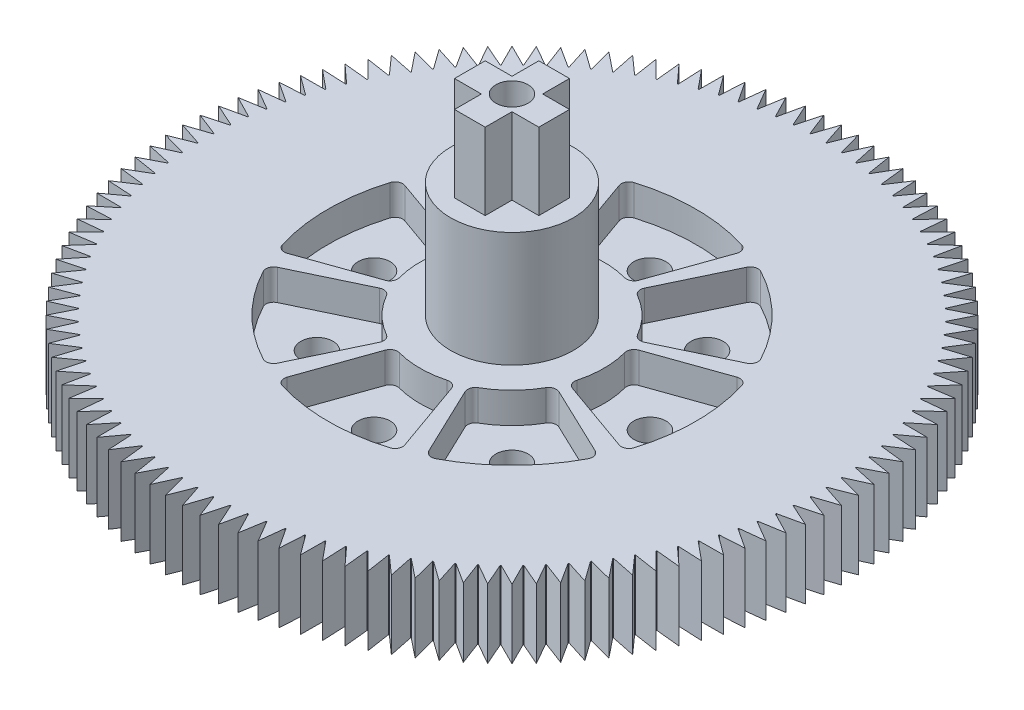
from build123d import *

# Parameters (mm, degrees)
SKETCH_1_R               = 25
SKETCH_1_R_2             = 2.1
EXTRUDE_1_DEPTH          = 5
SKETCH_2_R               = 25
SKETCH_2_R_2             = 24
SKETCH_2_R_3             = 12
EXTRUDE_2_DEPTH          = 4
FILLET_1_R               = 1
SKETCH_3_R               = 8
EXTRUDE_3_DEPTH          = 15
EXTRUDE_4_DEPTH          = 10
EXTRUDE_5_DEPTH          = 4
EXTRUDE_5_DEPTH_BACK     = 5
SKETCH_5_R               = 40
SKETCH_5_R_2             = 25
EXTRUDE_6_DEPTH          = 4
EXTRUDE_6_DEPTH_BACK     = 5
EXTRUDE_7_DEPTH          = 4
EXTRUDE_7_DEPTH_BACK     = 5
EXTRUDE_8_DEPTH          = 4
EXTRUDE_8_DEPTH_BACK     = 5
CUT_EXTRUDE_1_DEPTH      = 70.670653793
CUT_EXTRUDE_1_DEPTH_BACK = 70.670653793
SKETCH_6_R               = 2.1


with BuildPart() as part:
    # Эскиз1 → Бобышка-Вытянуть1 (new body)
    with BuildSketch(Plane(origin=(0, 0, 0), x_dir=(1, 0, 0), z_dir=(0, 1, 0))):
        with Locations(Location((0, 0, 0), (0, 0, 270))):
            Circle(SKETCH_1_R)
        with Locations(Location((-18, 0, 0), (0, 0, 270))):
            Circle(SKETCH_1_R_2, mode=Mode.SUBTRACT)
        with Locations(Location((-12.727922061, 12.727922061, 0), (0, 0, 270))):
            Circle(SKETCH_1_R_2, mode=Mode.SUBTRACT)
        with Locations(Location((0, 18, 0), (0, 0, 270))):
            Circle(SKETCH_1_R_2, mode=Mode.SUBTRACT)
        with Locations(Location((12.727922061, 12.727922061, 0), (0, 0, 270))):
            Circle(SKETCH_1_R_2, mode=Mode.SUBTRACT)
        with Locations(Location((18, 0, 0), (0, 0, 270))):
            Circle(SKETCH_1_R_2, mode=Mode.SUBTRACT)
        with Locations(Location((12.727922061, -12.727922061, 0), (0, 0, 270))):
            Circle(SKETCH_1_R_2, mode=Mode.SUBTRACT)
        with Locations(Location((0, -18, 0), (0, 0, 270))):
            Circle(SKETCH_1_R_2, mode=Mode.SUBTRACT)
        with Locations(Location((-12.727922061, -12.727922061, 0), (0, 0, 270))):
            Circle(SKETCH_1_R_2, mode=Mode.SUBTRACT)
    extrude(amount=EXTRUDE_1_DEPTH)

    # Эскиз2 → Бобышка-Вытянуть2 (add)
    # profile 1 of 10: a face of its own
    with BuildSketch(Plane(origin=(0, 5, 0), x_dir=(1, 0, 0), z_dir=(0, 1, 0))):
        with Locations(Location((0, 0, 0), (0, 0, 270))):
            Circle(SKETCH_2_R)
        Circle(SKETCH_2_R_2, mode=Mode.SUBTRACT)
    # profile 2 of 10: a face of its own
    with BuildSketch(Plane(origin=(0, 5, 0), x_dir=(1, 0, 0), z_dir=(0, 1, 0))):
        Circle(SKETCH_2_R_3)
    # profile 3 of 10: a face of its own
    with BuildSketch(Plane(origin=(0, 5, 0), x_dir=(1, 0, 0), z_dir=(0, 1, 0))):
        with BuildLine():
            Line((-10.332266323, 21.662046824), (-5.166133162, 10.831023412))
            ThreePointArc((-5.166133162, 10.831023412), (-4.592201188, 11.08655439), (-4.005682311, 11.311697893))
            Line((-4.005682311, 11.311697893), (-8.011364622, 22.623395786))
            ThreePointArc((-8.011364622, 22.623395786), (-9.184402377, 22.17310878), (-10.332266323, 21.662046824))
        make_face()
    # profile 4 of 10: a face of its own
    with BuildSketch(Plane(origin=(0, 5, 0), x_dir=(1, 0, 0), z_dir=(0, 1, 0))):
        with BuildLine():
            Line((8.011364622, 22.623395786), (4.005682311, 11.311697893))
            ThreePointArc((4.005682311, 11.311697893), (4.592201188, 11.08655439), (5.166133162, 10.831023412))
            Line((5.166133162, 10.831023412), (10.332266323, 21.662046824))
            ThreePointArc((10.332266323, 21.662046824), (9.184402377, 22.17310878), (8.011364622, 22.623395786))
        make_face()
    # profile 5 of 10: a face of its own
    with BuildSketch(Plane(origin=(0, 5, 0), x_dir=(1, 0, 0), z_dir=(0, 1, 0))):
        with BuildLine():
            ThreePointArc((10.831023412, 5.166133162), (11.08655439, 4.592201188), (11.311697893, 4.005682311))
            Line((11.311697893, 4.005682311), (22.623395786, 8.011364622))
            ThreePointArc((22.623395786, 8.011364622), (22.17310878, 9.184402377), (21.662046824, 10.332266323))
            Line((21.662046824, 10.332266323), (10.831023412, 5.166133162))
        make_face()
    # profile 6 of 10: a face of its own
    with BuildSketch(Plane(origin=(0, 5, 0), x_dir=(1, 0, 0), z_dir=(0, 1, 0))):
        with BuildLine():
            ThreePointArc((11.311697893, -4.005682311), (11.08655439, -4.592201188), (10.831023412, -5.166133162))
            Line((10.831023412, -5.166133162), (21.662046824, -10.332266323))
            ThreePointArc((21.662046824, -10.332266323), (22.17310878, -9.184402377), (22.623395786, -8.011364622))
            Line((22.623395786, -8.011364622), (11.311697893, -4.005682311))
        make_face()
    # profile 7 of 10: a face of its own
    with BuildSketch(Plane(origin=(0, 5, 0), x_dir=(1, 0, 0), z_dir=(0, 1, 0))):
        with BuildLine():
            ThreePointArc((5.166133162, -10.831023412), (4.592201188, -11.08655439), (4.005682311, -11.311697893))
            Line((4.005682311, -11.311697893), (8.011364622, -22.623395786))
            ThreePointArc((8.011364622, -22.623395786), (9.184402377, -22.17310878), (10.332266323, -21.662046824))
            Line((10.332266323, -21.662046824), (5.166133162, -10.831023412))
        make_face()
    # profile 8 of 10: a face of its own
    with BuildSketch(Plane(origin=(0, 5, 0), x_dir=(1, 0, 0), z_dir=(0, 1, 0))):
        with BuildLine():
            ThreePointArc((-4.005682311, -11.311697893), (-4.592201188, -11.08655439), (-5.166133162, -10.831023412))
            Line((-5.166133162, -10.831023412), (-10.332266323, -21.662046824))
            ThreePointArc((-10.332266323, -21.662046824), (-9.184402377, -22.17310878), (-8.011364622, -22.623395786))
            Line((-8.011364622, -22.623395786), (-4.005682311, -11.311697893))
        make_face()
    # profile 9 of 10: a face of its own
    with BuildSketch(Plane(origin=(0, 5, 0), x_dir=(1, 0, 0), z_dir=(0, 1, 0))):
        with BuildLine():
            Line((-21.662046824, -10.332266323), (-10.831023412, -5.166133162))
            ThreePointArc((-10.831023412, -5.166133162), (-11.08655439, -4.592201188), (-11.311697893, -4.005682311))
            Line((-11.311697893, -4.005682311), (-22.623395786, -8.011364622))
            ThreePointArc((-22.623395786, -8.011364622), (-22.17310878, -9.184402377), (-21.662046824, -10.332266323))
        make_face()
    # profile 10 of 10: a face of its own
    with BuildSketch(Plane(origin=(0, 5, 0), x_dir=(1, 0, 0), z_dir=(0, 1, 0))):
        with BuildLine():
            Line((-22.623395786, 8.011364622), (-11.311697893, 4.005682311))
            ThreePointArc((-11.311697893, 4.005682311), (-11.08655439, 4.592201188), (-10.831023412, 5.166133162))
            Line((-10.831023412, 5.166133162), (-21.662046824, 10.332266323))
            ThreePointArc((-21.662046824, 10.332266323), (-22.17310878, 9.184402377), (-22.623395786, 8.011364622))
        make_face()
    extrude(amount=EXTRUDE_2_DEPTH)

    # Скругление1
    fillet_1_edges = [part.edges().sort_by_distance(p)[0] for p in [
        (5.166133162, 7, 10.831023412),
        (10.831023412, 7, 5.166133162),
        (21.662046824, 7, 10.332266323),
        (22.623395786, 7, 8.011364622),
        (11.311697893, 7, 4.005682311),
        (11.311697893, 7, -4.005682311),
        (21.662046824, 7, -10.332266323),
        (10.831023412, 7, -5.166133162),
        (5.166133162, 7, -10.831023412),
        (8.011364622, 7, -22.623395786),
        (4.005682311, 7, -11.311697893),
        (-4.005682311, 7, -11.311697893),
        (-10.332266323, 7, -21.662046824),
        (-5.166133162, 7, -10.831023412),
        (-10.831023412, 7, -5.166133162),
        (-22.623395786, 7, -8.011364622),
        (-11.311697893, 7, -4.005682311),
        (-11.311697893, 7, 4.005682311),
        (-21.662046824, 7, 10.332266323),
        (-10.831023412, 7, 5.166133162),
        (-5.166133162, 7, 10.831023412),
        (-8.011364622, 7, 22.623395786),
        (-4.005682311, 7, 11.311697893),
        (4.005682311, 7, 11.311697893),
        (10.332266323, 7, 21.662046824),
        (22.623395786, 7, -8.011364622),
        (10.332266323, 7, -21.662046824),
        (-8.011364622, 7, -22.623395786),
        (-21.662046824, 7, -10.332266323),
        (-22.623395786, 7, 8.011364622),
        (-10.332266323, 7, 21.662046824),
        (8.011364622, 7, 22.623395786),
    ]]
    fillet(fillet_1_edges, radius=FILLET_1_R)

    # Эскиз3 → Бобышка-Вытянуть3 (add)
    with BuildSketch(Plane(origin=(0, 9, 0), x_dir=(1, 0, 0), z_dir=(0, 1, 0))):
        with Locations(Location((0, 0, 0), (0, 0, 270))):
            Circle(SKETCH_3_R)
    extrude(amount=EXTRUDE_3_DEPTH)

    # Эскиз4 → Бобышка-Вытянуть4 (add)
    with BuildSketch(Plane(origin=(0, 24, 0), x_dir=(1, 0, 0), z_dir=(0, 1, 0))):
        Polygon((-2, -5.5), (-2, -2), (-5.5, -2), (-5.5, 2), (-2, 2), (-2, 5.5), (2, 5.5), (2, 2), (5.5, 2), (5.5, -2), (2, -2), (2, -5.5), align=None)
    extrude(amount=EXTRUDE_4_DEPTH)

    # Эскиз5 → Бобышка-Вытянуть5 (add, two sides: drawn at the far end of the back side and taken through both)
    with BuildSketch(Plane(origin=(0, 5, 0), x_dir=(1, 0, 0), z_dir=(0, 1, 0)).offset(-EXTRUDE_5_DEPTH_BACK)):
        with Locations(Location((0, 0, 0), (0, 0, 270))):
            Circle(SKETCH_5_R)
        Circle(SKETCH_5_R_2, mode=Mode.SUBTRACT)
    extrude(amount=EXTRUDE_5_DEPTH + EXTRUDE_5_DEPTH_BACK)

    # Эскиз5<4> → Бобышка-Вытянуть6 (add, two sides: drawn at the far end of the back side and taken through both)
    with BuildSketch(Plane(origin=(0, 5, 0), x_dir=(1, 0, 0), z_dir=(0, 1, 0)).offset(-EXTRUDE_6_DEPTH_BACK)):
        with BuildLine():
            Line((0, 43), (-0.999921872, 39.9875))
            ThreePointArc((-0.999921872, 39.9875), (-3.0395e-05, 40), (0.999861101, 39.98750152))
            Line((0.999861101, 39.98750152), (0, 43))
        make_face()
        with BuildLine():
            ThreePointArc((-7.243034345, 39.338765276), (-6.257408622, 39.507528869), (-5.267872256, 39.651601757))
            Line((-5.267872256, 39.651601757), (-6.726681997, 42.470598646))
            Line((-6.726681997, 42.470598646), (-7.243034345, 39.338765276))
        make_face()
        with BuildLine():
            Line((6.726681997, 42.470598646), (5.267811996, 39.651609763))
            ThreePointArc((5.267811996, 39.651609763), (6.257348581, 39.507538379), (7.242974561, 39.338776284))
            Line((7.242974561, 39.338776284), (6.726681997, 42.470598646))
        make_face()
        with BuildLine():
            ThreePointArc((-11.315376926, 38.366160155), (-10.352791163, 38.637025185), (-9.383735299, 38.883743542))
            Line((-9.383735299, 38.883743542), (-11.129218939, 41.53481053))
            Line((-11.129218939, 41.53481053), (-11.315376926, 38.366160155))
        make_face()
        with BuildLine():
            Line((11.129218939, 41.53481053), (9.383676206, 38.883757803))
            ThreePointArc((9.383676206, 38.883757803), (10.352732445, 38.637040918), (11.31531862, 38.366177351))
            Line((11.31531862, 38.366177351), (11.129218939, 41.53481053))
        make_face()
        with BuildLine():
            ThreePointArc((-17.177855599, 36.123694122), (-16.26949349, 36.541805943), (-15.350963566, 36.937080524))
            Line((-15.350963566, 36.937080524), (-17.489675652, 39.282454679))
            Line((-17.489675652, 39.282454679), (-17.177855599, 36.123694122))
        make_face()
        with BuildLine():
            Line((17.489675652, 39.282454679), (15.350907431, 36.937103853))
            ThreePointArc((15.350907431, 36.937103853), (16.269437956, 36.541830668), (17.177800701, 36.123720228))
            Line((17.177800701, 36.123720228), (17.489675652, 39.282454679))
        make_face()
        with BuildLine():
            ThreePointArc((-22.617358457, 32.991742852), (-21.785586892, 33.546806164), (-20.940200162, 34.080903996))
            Line((-20.940200162, 34.080903996), (-23.419478506, 36.062834422))
            Line((-23.419478506, 36.062834422), (-22.617358457, 32.991742852))
        make_face()
        with BuildLine():
            Line((23.419478506, 36.062834422), (20.940148368, 34.080935819))
            ThreePointArc((20.940148368, 34.080935819), (21.785535909, 33.546839272), (22.617308318, 32.991777225))
            Line((22.617308318, 32.991777225), (23.419478506, 36.062834422))
        make_face()
        with BuildLine():
            ThreePointArc((-25.942034382, 30.44685291), (-25.172839263, 31.08581933), (-24.387912076, 31.705358294))
            Line((-24.387912076, 31.705358294), (-27.060776815, 33.417276343))
            Line((-27.060776815, 33.417276343), (-25.942034382, 30.44685291))
        make_face()
        with BuildLine():
            Line((27.060776815, 33.417276343), (24.387863893, 31.705395357))
            ThreePointArc((24.387863893, 31.705395357), (25.172792021, 31.085857586), (25.94198811, 30.446892335))
            Line((25.94198811, 30.446892335), (27.060776815, 33.417276343))
        make_face()
        with BuildLine():
            ThreePointArc((-30.385582037, 26.013773357), (-29.725813357, 26.765201667), (-29.047467173, 27.499902742))
            Line((-29.047467173, 27.499902742), (-31.955227496, 28.772616073))
            Line((-31.955227496, 28.772616073), (-30.385582037, 26.013773357))
        make_face()
        with BuildLine():
            Line((31.955227496, 28.772616073), (29.04742538, 27.499946887))
            ThreePointArc((29.04742538, 27.499946887), (29.725772681, 26.765246842), (30.385542503, 26.013819535))
            Line((30.385542503, 26.013819535), (31.955227496, 28.772616073))
        make_face()
        with BuildLine():
            ThreePointArc((-34.080935819, 20.940148368), (-33.546839272, 21.785535909), (-32.991777225, 22.617308318))
            Line((-32.991777225, 22.617308318), (-36.062834422, 23.419478506))
            Line((-36.062834422, 23.419478506), (-34.080935819, 20.940148368))
        make_face()
        with BuildLine():
            Line((36.062834422, 23.419478506), (32.991742852, 22.617358457))
            ThreePointArc((32.991742852, 22.617358457), (33.546806164, 21.785586892), (34.080903996, 20.940200162))
            Line((34.080903996, 20.940200162), (36.062834422, 23.419478506))
        make_face()
        with BuildLine():
            ThreePointArc((-36.083078416, 17.263008197), (-35.640274766, 18.159592908), (-35.175197299, 19.044828563))
            Line((-35.175197299, 19.044828563), (-38.31328054, 19.521591489))
            Line((-38.31328054, 19.521591489), (-36.083078416, 17.263008197))
        make_face()
        with BuildLine():
            Line((38.31328054, 19.521591489), (35.175168356, 19.04488202))
            ThreePointArc((35.175168356, 19.04488202), (35.640247169, 18.159647071), (36.083052181, 17.263063034))
            Line((36.083052181, 17.263063034), (38.31328054, 19.521591489))
        make_face()
        with BuildLine():
            ThreePointArc((-38.339365297, 11.40583485), (-38.042270044, 12.360650868), (-37.721399818, 13.307741948))
            Line((-37.721399818, 13.307741948), (-40.895430201, 13.287730758))
            Line((-40.895430201, 13.287730758), (-38.339365297, 11.40583485))
        make_face()
        with BuildLine():
            Line((40.895430201, 13.287730758), (37.721379594, 13.307799275))
            ThreePointArc((37.721379594, 13.307799275), (38.042251259, 12.360708682), (38.339347963, 11.405893116))
            Line((38.339347963, 11.405893116), (40.895430201, 13.287730758))
        make_face()
        with BuildLine():
            ThreePointArc((-39.651609763, 5.267811996), (-39.507538379, 6.257348581), (-39.338776284, 7.242974561))
            Line((-39.338776284, 7.242974561), (-42.470598646, 6.726681997))
            Line((-42.470598646, 6.726681997), (-39.651609763, 5.267811996))
        make_face()
        with BuildLine():
            Line((42.470598646, 6.726681997), (39.338765276, 7.243034345))
            ThreePointArc((39.338765276, 7.243034345), (39.507528869, 6.257408622), (39.651601757, 5.267872256))
            Line((39.651601757, 5.267872256), (42.470598646, 6.726681997))
        make_face()
        with BuildLine():
            ThreePointArc((-39.985030388, 1.094232536), (-39.945182981, 2.093407897), (-39.880371352, 3.091274956))
            Line((-39.880371352, 3.091274956), (-42.941069994, 2.250446118))
            Line((-42.941069994, 2.250446118), (-39.985030388, 1.094232536))
        make_face()
        with BuildLine():
            Line((42.941069994, 2.250446118), (39.880366654, 3.091335564))
            ThreePointArc((39.880366654, 3.091335564), (39.945179799, 2.093468603), (39.985028725, 1.094293303))
            Line((39.985028725, 1.094293303), (42.941069994, 2.250446118))
        make_face()
        with BuildLine():
            ThreePointArc((-39.663923994, -5.17427612), (-39.780872638, -4.181168759), (-39.872959747, -3.185448326))
            Line((-39.872959747, -3.185448326), (-42.764441501, -4.494723921))
            Line((-42.764441501, -4.494723921), (-39.663923994, -5.17427612))
        make_face()
        with BuildLine():
            Line((42.764441501, -4.494723921), (39.872964588, -3.18538773))
            ThreePointArc((39.872964588, -3.18538773), (39.780878992, -4.181108302), (39.663931858, -5.174215841))
            Line((39.663931858, -5.174215841), (42.764441501, -4.494723921))
        make_face()
        with BuildLine():
            ThreePointArc((-38.366160155, -11.315376926), (-38.637025185, -10.352791163), (-38.883743542, -9.383735299))
            Line((-38.883743542, -9.383735299), (-41.53481053, -11.129218939))
            Line((-41.53481053, -11.129218939), (-38.366160155, -11.315376926))
        make_face()
        with BuildLine():
            Line((41.53481053, -11.129218939), (38.883757803, -9.383676206))
            ThreePointArc((38.883757803, -9.383676206), (38.637040918, -10.352732445), (38.366177351, -11.31531862))
            Line((38.366177351, -11.31531862), (41.53481053, -11.129218939))
        make_face()
        with BuildLine():
            ThreePointArc((-36.973207354, -15.26374587), (-37.343206167, -14.334746358), (-37.689866896, -13.396788173))
            Line((-37.689866896, -13.396788173), (-40.143958339, -15.40982183))
            Line((-40.143958339, -15.40982183), (-36.973207354, -15.26374587))
        make_face()
        with BuildLine():
            Line((40.143958339, -15.40982183), (37.689887256, -13.396730895))
            ThreePointArc((37.689887256, -13.396730895), (37.343227952, -14.334689606), (36.97323055, -15.263689681))
            Line((36.97323055, -15.263689681), (40.143958339, -15.40982183))
        make_face()
        with BuildLine():
            ThreePointArc((-34.130229898, -20.859707743), (-34.641000954, -20.000026323), (-35.130122701, -19.127845646))
            Line((-35.130122701, -19.127845646), (-37.239092363, -21.5))
            Line((-37.239092363, -21.5), (-34.130229898, -20.859707743))
        make_face()
        with BuildLine():
            Line((37.239092363, -21.5), (35.13015177, -19.127792257))
            ThreePointArc((35.13015177, -19.127792257), (34.641031349, -19.999973677), (34.130261599, -20.859655874))
            Line((34.130261599, -20.859655874), (37.239092363, -21.5))
        make_face()
        with BuildLine():
            ThreePointArc((-30.44685291, -25.942034382), (-31.08581933, -25.172839263), (-31.705358294, -24.387912076))
            Line((-31.705358294, -24.387912076), (-33.417276343, -27.060776815))
            Line((-33.417276343, -27.060776815), (-30.44685291, -25.942034382))
        make_face()
        with BuildLine():
            Line((33.417276343, -27.060776815), (31.705395357, -24.387863893))
            ThreePointArc((31.705395357, -24.387863893), (31.085857586, -25.172792021), (30.446892335, -25.94198811))
            Line((30.446892335, -25.94198811), (33.417276343, -27.060776815))
        make_face()
        with BuildLine():
            ThreePointArc((-27.568380876, -28.982483949), (-28.284249755, -28.28429274), (-28.982442052, -27.568424922))
            Line((-28.982442052, -27.568424922), (-30.405591591, -30.405591591))
            Line((-30.405591591, -30.405591591), (-27.568380876, -28.982483949))
        make_face()
        with BuildLine():
            Line((30.405591591, -30.405591591), (28.982483949, -27.568380876))
            ThreePointArc((28.982483949, -27.568380876), (28.28429274, -28.284249755), (27.568424922, -28.982442052))
            Line((27.568424922, -28.982442052), (30.405591591, -30.405591591))
        make_face()
        with BuildLine():
            ThreePointArc((-22.695108989, -32.938306392), (-23.511385502, -32.360697641), (-24.312968292, -31.762864682))
            Line((-24.312968292, -31.762864682), (-25.274765849, -34.787730758))
            Line((-25.274765849, -34.787730758), (-22.695108989, -32.938306392))
        make_face()
        with BuildLine():
            Line((25.274765849, -34.787730758), (24.313016563, -31.762827733))
            ThreePointArc((24.313016563, -31.762827733), (23.511434682, -32.360661909), (22.695159046, -32.938271902))
            Line((22.695159046, -32.938271902), (25.274765849, -34.787730758))
        make_face()
        with BuildLine():
            ThreePointArc((-17.263008197, -36.083078416), (-18.159592908, -35.640274766), (-19.044828563, -35.175197299))
            Line((-19.044828563, -35.175197299), (-19.521591489, -38.31328054))
            Line((-19.521591489, -38.31328054), (-17.263008197, -36.083078416))
        make_face()
        with BuildLine():
            Line((19.521591489, -38.31328054), (19.04488202, -35.175168356))
            ThreePointArc((19.04488202, -35.175168356), (18.159647071, -35.640247169), (17.263063034, -36.083052181))
            Line((17.263063034, -36.083052181), (19.521591489, -38.31328054))
        make_face()
        with BuildLine():
            ThreePointArc((-13.396730895, -37.689887256), (-14.334689606, -37.343227952), (-15.263689681, -36.97323055))
            Line((-15.263689681, -36.97323055), (-15.40982183, -40.143958339))
            Line((-15.40982183, -40.143958339), (-13.396730895, -37.689887256))
        make_face()
        with BuildLine():
            Line((15.40982183, -40.143958339), (15.26374587, -36.973207354))
            ThreePointArc((15.26374587, -36.973207354), (14.334746358, -37.343206167), (13.396788173, -37.689866896))
            Line((13.396788173, -37.689866896), (15.40982183, -40.143958339))
        make_face()
        with BuildLine():
            ThreePointArc((-7.335797557, -39.321572631), (-8.316437902, -39.125910349), (-9.29188079, -38.905795859))
            Line((-9.29188079, -38.905795859), (-8.940202705, -42.060346832))
            Line((-8.940202705, -42.060346832), (-7.335797557, -39.321572631))
        make_face()
        with BuildLine():
            Line((8.940202705, -42.060346832), (9.291939917, -38.905781737))
            ThreePointArc((9.291939917, -38.905781737), (8.316497363, -39.12589771), (7.335857315, -39.321561483))
            Line((7.335857315, -39.321561483), (8.940202705, -42.060346832))
        make_face()
        with BuildLine():
            ThreePointArc((-1.094232536, -39.985030388), (-2.093407897, -39.945182981), (-3.091274956, -39.880371352))
            Line((-3.091274956, -39.880371352), (-2.250446118, -42.941069994))
            Line((-2.250446118, -42.941069994), (-1.094232536, -39.985030388))
        make_face()
        with BuildLine():
            Line((2.250446118, -42.941069994), (3.091335564, -39.880366654))
            ThreePointArc((3.091335564, -39.880366654), (2.093468603, -39.945179799), (1.094293303, -39.985028725))
            Line((1.094293303, -39.985028725), (2.250446118, -42.941069994))
        make_face()
    extrude(amount=EXTRUDE_6_DEPTH + EXTRUDE_6_DEPTH_BACK)

    # Эскиз5<5> → Бобышка-Вытянуть7 (add, two sides: drawn at the far end of the back side and taken through both)
    with BuildSketch(Plane(origin=(0, 5, 0), x_dir=(1, 0, 0), z_dir=(0, 1, 0)).offset(-EXTRUDE_7_DEPTH_BACK)):
        with BuildLine():
            ThreePointArc((-3.091335564, 39.880366654), (-2.093468603, 39.945179799), (-1.094293303, 39.985028725))
            Line((-1.094293303, 39.985028725), (-2.250446118, 42.941069994))
            Line((-2.250446118, 42.941069994), (-3.091335564, 39.880366654))
        make_face()
        with BuildLine():
            Line((2.250446118, 42.941069994), (1.094232536, 39.985030388))
            ThreePointArc((1.094232536, 39.985030388), (2.093407897, 39.945182981), (3.091274956, 39.880371352))
            Line((3.091274956, 39.880371352), (2.250446118, 42.941069994))
        make_face()
        with BuildLine():
            ThreePointArc((-9.291939917, 38.905781737), (-8.316497363, 39.12589771), (-7.335857315, 39.321561483))
            Line((-7.335857315, 39.321561483), (-8.940202705, 42.060346832))
            Line((-8.940202705, 42.060346832), (-9.291939917, 38.905781737))
        make_face()
        with BuildLine():
            Line((8.940202705, 42.060346832), (7.335797557, 39.321572631))
            ThreePointArc((7.335797557, 39.321572631), (8.316437902, 39.125910349), (9.29188079, 38.905795859))
            Line((9.29188079, 38.905795859), (8.940202705, 42.060346832))
        make_face()
        with BuildLine():
            ThreePointArc((-15.26374587, 36.973207354), (-14.334746358, 37.343206167), (-13.396788173, 37.689866896))
            Line((-13.396788173, 37.689866896), (-15.40982183, 40.143958339))
            Line((-15.40982183, 40.143958339), (-15.26374587, 36.973207354))
        make_face()
        with BuildLine():
            Line((15.40982183, 40.143958339), (13.396730895, 37.689887256))
            ThreePointArc((13.396730895, 37.689887256), (14.334689606, 37.343227952), (15.263689681, 36.97323055))
            Line((15.263689681, 36.97323055), (15.40982183, 40.143958339))
        make_face()
        with BuildLine():
            ThreePointArc((-19.04488202, 35.175168356), (-18.159647071, 35.640247169), (-17.263063034, 36.083052181))
            Line((-17.263063034, 36.083052181), (-19.521591489, 38.31328054))
            Line((-19.521591489, 38.31328054), (-19.04488202, 35.175168356))
        make_face()
        with BuildLine():
            Line((19.521591489, 38.31328054), (17.263008197, 36.083078416))
            ThreePointArc((17.263008197, 36.083078416), (18.159592908, 35.640274766), (19.044828563, 35.175197299))
            Line((19.044828563, 35.175197299), (19.521591489, 38.31328054))
        make_face()
        with BuildLine():
            ThreePointArc((-24.313016563, 31.762827733), (-23.511434682, 32.360661909), (-22.695159046, 32.938271902))
            Line((-22.695159046, 32.938271902), (-25.274765849, 34.787730758))
            Line((-25.274765849, 34.787730758), (-24.313016563, 31.762827733))
        make_face()
        with BuildLine():
            Line((25.274765849, 34.787730758), (22.695108989, 32.938306392))
            ThreePointArc((22.695108989, 32.938306392), (23.511385502, 32.360697641), (24.312968292, 31.762864682))
            Line((24.312968292, 31.762864682), (25.274765849, 34.787730758))
        make_face()
        with BuildLine():
            ThreePointArc((-28.982483949, 27.568380876), (-28.28429274, 28.284249755), (-27.568424922, 28.982442052))
            Line((-27.568424922, 28.982442052), (-30.405591591, 30.405591591))
            Line((-30.405591591, 30.405591591), (-28.982483949, 27.568380876))
        make_face()
        with BuildLine():
            Line((30.405591591, 30.405591591), (27.568380876, 28.982483949))
            ThreePointArc((27.568380876, 28.982483949), (28.284249755, 28.28429274), (28.982442052, 27.568424922))
            Line((28.982442052, 27.568424922), (30.405591591, 30.405591591))
        make_face()
        with BuildLine():
            ThreePointArc((-31.705395357, 24.387863893), (-31.085857586, 25.172792021), (-30.446892335, 25.94198811))
            Line((-30.446892335, 25.94198811), (-33.417276343, 27.060776815))
            Line((-33.417276343, 27.060776815), (-31.705395357, 24.387863893))
        make_face()
        with BuildLine():
            Line((33.417276343, 27.060776815), (30.44685291, 25.942034382))
            ThreePointArc((30.44685291, 25.942034382), (31.08581933, 25.172839263), (31.705358294, 24.387912076))
            Line((31.705358294, 24.387912076), (33.417276343, 27.060776815))
        make_face()
        with BuildLine():
            ThreePointArc((-35.13015177, 19.127792257), (-34.641031349, 19.999973677), (-34.130261599, 20.859655874))
            Line((-34.130261599, 20.859655874), (-37.239092363, 21.5))
            Line((-37.239092363, 21.5), (-35.13015177, 19.127792257))
        make_face()
        with BuildLine():
            Line((37.239092363, 21.5), (34.130229898, 20.859707743))
            ThreePointArc((34.130229898, 20.859707743), (34.641000954, 20.000026323), (35.130122701, 19.127845646))
            Line((35.130122701, 19.127845646), (37.239092363, 21.5))
        make_face()
        with BuildLine():
            ThreePointArc((-37.689887256, 13.396730895), (-37.343227952, 14.334689606), (-36.97323055, 15.263689681))
            Line((-36.97323055, 15.263689681), (-40.143958339, 15.40982183))
            Line((-40.143958339, 15.40982183), (-37.689887256, 13.396730895))
        make_face()
        with BuildLine():
            Line((40.143958339, 15.40982183), (36.973207354, 15.26374587))
            ThreePointArc((36.973207354, 15.26374587), (37.343206167, 14.334746358), (37.689866896, 13.396788173))
            Line((37.689866896, 13.396788173), (40.143958339, 15.40982183))
        make_face()
        with BuildLine():
            ThreePointArc((-38.883757803, 9.383676206), (-38.637040918, 10.352732445), (-38.366177351, 11.31531862))
            Line((-38.366177351, 11.31531862), (-41.53481053, 11.129218939))
            Line((-41.53481053, 11.129218939), (-38.883757803, 9.383676206))
        make_face()
        with BuildLine():
            Line((41.53481053, 11.129218939), (38.366160155, 11.315376926))
            ThreePointArc((38.366160155, 11.315376926), (38.637025185, 10.352791163), (38.883743542, 9.383735299))
            Line((38.883743542, 9.383735299), (41.53481053, 11.129218939))
        make_face()
        with BuildLine():
            ThreePointArc((-39.872964588, 3.18538773), (-39.780878992, 4.181108302), (-39.663931858, 5.174215841))
            Line((-39.663931858, 5.174215841), (-42.764441501, 4.494723921))
            Line((-42.764441501, 4.494723921), (-39.872964588, 3.18538773))
        make_face()
        with BuildLine():
            Line((42.764441501, 4.494723921), (39.663923994, 5.17427612))
            ThreePointArc((39.663923994, 5.17427612), (39.780872638, 4.181168759), (39.872959747, 3.185448326))
            Line((39.872959747, 3.185448326), (42.764441501, 4.494723921))
        make_face()
        with BuildLine():
            ThreePointArc((-39.880366654, -3.091335564), (-39.945179799, -2.093468603), (-39.985028725, -1.094293303))
            Line((-39.985028725, -1.094293303), (-42.941069994, -2.250446118))
            Line((-42.941069994, -2.250446118), (-39.880366654, -3.091335564))
        make_face()
        with BuildLine():
            Line((42.941069994, -2.250446118), (39.985030388, -1.094232536))
            ThreePointArc((39.985030388, -1.094232536), (39.945182981, -2.093407897), (39.880371352, -3.091274956))
            Line((39.880371352, -3.091274956), (42.941069994, -2.250446118))
        make_face()
        with BuildLine():
            ThreePointArc((-39.338765276, -7.243034345), (-39.507528869, -6.257408622), (-39.651601757, -5.267872256))
            Line((-39.651601757, -5.267872256), (-42.470598646, -6.726681997))
            Line((-42.470598646, -6.726681997), (-39.338765276, -7.243034345))
        make_face()
        with BuildLine():
            Line((42.470598646, -6.726681997), (39.651609763, -5.267811996))
            ThreePointArc((39.651609763, -5.267811996), (39.507538379, -6.257348581), (39.338776284, -7.242974561))
            Line((39.338776284, -7.242974561), (42.470598646, -6.726681997))
        make_face()
        with BuildLine():
            ThreePointArc((-37.721379594, -13.307799275), (-38.042251259, -12.360708682), (-38.339347963, -11.405893116))
            Line((-38.339347963, -11.405893116), (-40.895430201, -13.287730758))
            Line((-40.895430201, -13.287730758), (-37.721379594, -13.307799275))
        make_face()
        with BuildLine():
            Line((40.895430201, -13.287730758), (38.339365297, -11.40583485))
            ThreePointArc((38.339365297, -11.40583485), (38.042270044, -12.360650868), (37.721399818, -13.307741948))
            Line((37.721399818, -13.307741948), (40.895430201, -13.287730758))
        make_face()
        with BuildLine():
            ThreePointArc((-35.175168356, -19.04488202), (-35.640247169, -18.159647071), (-36.083052181, -17.263063034))
            Line((-36.083052181, -17.263063034), (-38.31328054, -19.521591489))
            Line((-38.31328054, -19.521591489), (-35.175168356, -19.04488202))
        make_face()
        with BuildLine():
            Line((38.31328054, -19.521591489), (36.083078416, -17.263008197))
            ThreePointArc((36.083078416, -17.263008197), (35.640274766, -18.159592908), (35.175197299, -19.044828563))
            Line((35.175197299, -19.044828563), (38.31328054, -19.521591489))
        make_face()
        with BuildLine():
            ThreePointArc((-32.991742852, -22.617358457), (-33.546806164, -21.785586892), (-34.080903996, -20.940200162))
            Line((-34.080903996, -20.940200162), (-36.062834422, -23.419478506))
            Line((-36.062834422, -23.419478506), (-32.991742852, -22.617358457))
        make_face()
        with BuildLine():
            Line((36.062834422, -23.419478506), (34.080935819, -20.940148368))
            ThreePointArc((34.080935819, -20.940148368), (33.546839272, -21.785535909), (32.991777225, -22.617308318))
            Line((32.991777225, -22.617308318), (36.062834422, -23.419478506))
        make_face()
        with BuildLine():
            ThreePointArc((-29.04742538, -27.499946887), (-29.725772681, -26.765246842), (-30.385542503, -26.013819535))
            Line((-30.385542503, -26.013819535), (-31.955227496, -28.772616073))
            Line((-31.955227496, -28.772616073), (-29.04742538, -27.499946887))
        make_face()
        with BuildLine():
            Line((31.955227496, -28.772616073), (30.385582037, -26.013773357))
            ThreePointArc((30.385582037, -26.013773357), (29.725813357, -26.765201667), (29.047467173, -27.499902742))
            Line((29.047467173, -27.499902742), (31.955227496, -28.772616073))
        make_face()
        with BuildLine():
            ThreePointArc((-24.387863893, -31.705395357), (-25.172792021, -31.085857586), (-25.94198811, -30.446892335))
            Line((-25.94198811, -30.446892335), (-27.060776815, -33.417276343))
            Line((-27.060776815, -33.417276343), (-24.387863893, -31.705395357))
        make_face()
        with BuildLine():
            Line((27.060776815, -33.417276343), (25.942034382, -30.44685291))
            ThreePointArc((25.942034382, -30.44685291), (25.172839263, -31.08581933), (24.387912076, -31.705358294))
            Line((24.387912076, -31.705358294), (27.060776815, -33.417276343))
        make_face()
        with BuildLine():
            ThreePointArc((-20.940148368, -34.080935819), (-21.785535909, -33.546839272), (-22.617308318, -32.991777225))
            Line((-22.617308318, -32.991777225), (-23.419478506, -36.062834422))
            Line((-23.419478506, -36.062834422), (-20.940148368, -34.080935819))
        make_face()
        with BuildLine():
            Line((23.419478506, -36.062834422), (22.617358457, -32.991742852))
            ThreePointArc((22.617358457, -32.991742852), (21.785586892, -33.546806164), (20.940200162, -34.080903996))
            Line((20.940200162, -34.080903996), (23.419478506, -36.062834422))
        make_face()
        with BuildLine():
            ThreePointArc((-15.350907431, -36.937103853), (-16.269437956, -36.541830668), (-17.177800701, -36.123720228))
            Line((-17.177800701, -36.123720228), (-17.489675652, -39.282454679))
            Line((-17.489675652, -39.282454679), (-15.350907431, -36.937103853))
        make_face()
        with BuildLine():
            Line((17.489675652, -39.282454679), (17.177855599, -36.123694122))
            ThreePointArc((17.177855599, -36.123694122), (16.26949349, -36.541805943), (15.350963566, -36.937080524))
            Line((15.350963566, -36.937080524), (17.489675652, -39.282454679))
        make_face()
        with BuildLine():
            ThreePointArc((-9.383676206, -38.883757803), (-10.352732445, -38.637040918), (-11.31531862, -38.366177351))
            Line((-11.31531862, -38.366177351), (-11.129218939, -41.53481053))
            Line((-11.129218939, -41.53481053), (-9.383676206, -38.883757803))
        make_face()
        with BuildLine():
            Line((11.129218939, -41.53481053), (11.315376926, -38.366160155))
            ThreePointArc((11.315376926, -38.366160155), (10.352791163, -38.637025185), (9.383735299, -38.883743542))
            Line((9.383735299, -38.883743542), (11.129218939, -41.53481053))
        make_face()
        with BuildLine():
            ThreePointArc((-5.267811996, -39.651609763), (-6.257348581, -39.507538379), (-7.242974561, -39.338776284))
            Line((-7.242974561, -39.338776284), (-6.726681997, -42.470598646))
            Line((-6.726681997, -42.470598646), (-5.267811996, -39.651609763))
        make_face()
        with BuildLine():
            Line((6.726681997, -42.470598646), (7.243034345, -39.338765276))
            ThreePointArc((7.243034345, -39.338765276), (6.257408622, -39.507528869), (5.267872256, -39.651601757))
            Line((5.267872256, -39.651601757), (6.726681997, -42.470598646))
        make_face()
        with BuildLine():
            ThreePointArc((0.999921872, -39.9875), (3.0395e-05, -40), (-0.999861101, -39.98750152))
            Line((-0.999861101, -39.98750152), (0, -43))
            Line((0, -43), (0.999921872, -39.9875))
        make_face()
    extrude(amount=EXTRUDE_7_DEPTH + EXTRUDE_7_DEPTH_BACK)

    # Эскиз5<6> → Бобышка-Вытянуть8 (add, two sides: drawn at the far end of the back side and taken through both)
    with BuildSketch(Plane(origin=(0, 5, 0), x_dir=(1, 0, 0), z_dir=(0, 1, 0)).offset(-EXTRUDE_8_DEPTH_BACK)):
        with BuildLine():
            ThreePointArc((-13.307799275, 37.721379594), (-12.360708682, 38.042251259), (-11.405893116, 38.339347963))
            Line((-11.405893116, 38.339347963), (-13.287730758, 40.895430201))
            Line((-13.287730758, 40.895430201), (-13.307799275, 37.721379594))
        make_face()
        with BuildLine():
            ThreePointArc((-5.17427612, 39.663923994), (-4.181168759, 39.780872638), (-3.185448326, 39.872959747))
            Line((-3.185448326, 39.872959747), (-4.494723921, 42.764441501))
            Line((-4.494723921, 42.764441501), (-5.17427612, 39.663923994))
        make_face()
        with BuildLine():
            Line((4.494723921, 42.764441501), (3.18538773, 39.872964588))
            ThreePointArc((3.18538773, 39.872964588), (4.181108302, 39.780878992), (5.174215841, 39.663931858))
            Line((5.174215841, 39.663931858), (4.494723921, 42.764441501))
        make_face()
        with BuildLine():
            Line((13.287730758, 40.895430201), (11.40583485, 38.339365297))
            ThreePointArc((11.40583485, 38.339365297), (12.360650868, 38.042270044), (13.307741948, 37.721399818))
            Line((13.307741948, 37.721399818), (13.287730758, 40.895430201))
        make_face()
        with BuildLine():
            Line((21.5, 37.239092363), (19.127792257, 35.13015177))
            ThreePointArc((19.127792257, 35.13015177), (19.999973677, 34.641031349), (20.859655874, 34.130261599))
            Line((20.859655874, 34.130261599), (21.5, 37.239092363))
        make_face()
        with BuildLine():
            Line((28.772616073, 31.955227496), (26.013773357, 30.385582037))
            ThreePointArc((26.013773357, 30.385582037), (26.765201667, 29.725813357), (27.499902742, 29.047467173))
            Line((27.499902742, 29.047467173), (28.772616073, 31.955227496))
        make_face()
        with BuildLine():
            Line((34.787730758, 25.274765849), (31.762827733, 24.313016563))
            ThreePointArc((31.762827733, 24.313016563), (32.360661909, 23.511434682), (32.938271902, 22.695159046))
            Line((32.938271902, 22.695159046), (34.787730758, 25.274765849))
        make_face()
        with BuildLine():
            Line((39.282454679, 17.489675652), (36.123694122, 17.177855599))
            ThreePointArc((36.123694122, 17.177855599), (36.541805943, 16.26949349), (36.937080524, 15.350963566))
            Line((36.937080524, 15.350963566), (39.282454679, 17.489675652))
        make_face()
        with BuildLine():
            Line((42.060346832, 8.940202705), (38.905781737, 9.291939917))
            ThreePointArc((38.905781737, 9.291939917), (39.12589771, 8.316497363), (39.321561483, 7.335857315))
            Line((39.321561483, 7.335857315), (42.060346832, 8.940202705))
        make_face()
        with BuildLine():
            Line((43, 0), (39.9875, 0.999921872))
            ThreePointArc((39.9875, 0.999921872), (39.996874878, 0.5), (40, 0))
            ThreePointArc((40, 0), (39.996875258, -0.499969608), (39.98750152, -0.999861101))
            Line((39.98750152, -0.999861101), (43, 0))
        make_face()
        with BuildLine():
            Line((42.060346832, -8.940202705), (39.321572631, -7.335797557))
            ThreePointArc((39.321572631, -7.335797557), (39.125910349, -8.316437902), (38.905795859, -9.29188079))
            Line((38.905795859, -9.29188079), (42.060346832, -8.940202705))
        make_face()
        with BuildLine():
            Line((39.282454679, -17.489675652), (36.937103853, -15.350907431))
            ThreePointArc((36.937103853, -15.350907431), (36.541830668, -16.269437956), (36.123720228, -17.177800701))
            Line((36.123720228, -17.177800701), (39.282454679, -17.489675652))
        make_face()
        with BuildLine():
            Line((34.787730758, -25.274765849), (32.938306392, -22.695108989))
            ThreePointArc((32.938306392, -22.695108989), (32.360697641, -23.511385502), (31.762864682, -24.312968292))
            Line((31.762864682, -24.312968292), (34.787730758, -25.274765849))
        make_face()
        with BuildLine():
            Line((28.772616073, -31.955227496), (27.499946887, -29.04742538))
            ThreePointArc((27.499946887, -29.04742538), (26.765246842, -29.725772681), (26.013819535, -30.385542503))
            Line((26.013819535, -30.385542503), (28.772616073, -31.955227496))
        make_face()
        with BuildLine():
            Line((21.5, -37.239092363), (20.859707743, -34.130229898))
            ThreePointArc((20.859707743, -34.130229898), (20.000026323, -34.641000954), (19.127845646, -35.130122701))
            Line((19.127845646, -35.130122701), (21.5, -37.239092363))
        make_face()
        with BuildLine():
            Line((13.287730758, -40.895430201), (13.307799275, -37.721379594))
            ThreePointArc((13.307799275, -37.721379594), (12.360708682, -38.042251259), (11.405893116, -38.339347963))
            Line((11.405893116, -38.339347963), (13.287730758, -40.895430201))
        make_face()
        with BuildLine():
            Line((4.494723921, -42.764441501), (5.17427612, -39.663923994))
            ThreePointArc((5.17427612, -39.663923994), (4.181168759, -39.780872638), (3.185448326, -39.872959747))
            Line((3.185448326, -39.872959747), (4.494723921, -42.764441501))
        make_face()
        with BuildLine():
            ThreePointArc((-3.18538773, -39.872964588), (-4.181108302, -39.780878992), (-5.174215841, -39.663931858))
            Line((-5.174215841, -39.663931858), (-4.494723921, -42.764441501))
            Line((-4.494723921, -42.764441501), (-3.18538773, -39.872964588))
        make_face()
        with BuildLine():
            ThreePointArc((-11.40583485, -38.339365297), (-12.360650868, -38.042270044), (-13.307741948, -37.721399818))
            Line((-13.307741948, -37.721399818), (-13.287730758, -40.895430201))
            Line((-13.287730758, -40.895430201), (-11.40583485, -38.339365297))
        make_face()
        with BuildLine():
            ThreePointArc((-19.127792257, -35.13015177), (-19.999973677, -34.641031349), (-20.859655874, -34.130261599))
            Line((-20.859655874, -34.130261599), (-21.5, -37.239092363))
            Line((-21.5, -37.239092363), (-19.127792257, -35.13015177))
        make_face()
        with BuildLine():
            ThreePointArc((-26.013773357, -30.385582037), (-26.765201667, -29.725813357), (-27.499902742, -29.047467173))
            Line((-27.499902742, -29.047467173), (-28.772616073, -31.955227496))
            Line((-28.772616073, -31.955227496), (-26.013773357, -30.385582037))
        make_face()
        with BuildLine():
            ThreePointArc((-31.762827733, -24.313016563), (-32.360661909, -23.511434682), (-32.938271902, -22.695159046))
            Line((-32.938271902, -22.695159046), (-34.787730758, -25.274765849))
            Line((-34.787730758, -25.274765849), (-31.762827733, -24.313016563))
        make_face()
        with BuildLine():
            ThreePointArc((-36.123694122, -17.177855599), (-36.541805943, -16.26949349), (-36.937080524, -15.350963566))
            Line((-36.937080524, -15.350963566), (-39.282454679, -17.489675652))
            Line((-39.282454679, -17.489675652), (-36.123694122, -17.177855599))
        make_face()
        with BuildLine():
            ThreePointArc((-38.905781737, -9.291939917), (-39.12589771, -8.316497363), (-39.321561483, -7.335857315))
            Line((-39.321561483, -7.335857315), (-42.060346832, -8.940202705))
            Line((-42.060346832, -8.940202705), (-38.905781737, -9.291939917))
        make_face()
        with BuildLine():
            ThreePointArc((-39.9875, -0.999921872), (-40, -3.0395e-05), (-39.98750152, 0.999861101))
            Line((-39.98750152, 0.999861101), (-43, 0))
            Line((-43, 0), (-39.9875, -0.999921872))
        make_face()
        with BuildLine():
            ThreePointArc((-39.321572631, 7.335797557), (-39.125910349, 8.316437902), (-38.905795859, 9.29188079))
            Line((-38.905795859, 9.29188079), (-42.060346832, 8.940202705))
            Line((-42.060346832, 8.940202705), (-39.321572631, 7.335797557))
        make_face()
        with BuildLine():
            ThreePointArc((-36.937103853, 15.350907431), (-36.541830668, 16.269437956), (-36.123720228, 17.177800701))
            Line((-36.123720228, 17.177800701), (-39.282454679, 17.489675652))
            Line((-39.282454679, 17.489675652), (-36.937103853, 15.350907431))
        make_face()
        with BuildLine():
            ThreePointArc((-32.938306392, 22.695108989), (-32.360697641, 23.511385502), (-31.762864682, 24.312968292))
            Line((-31.762864682, 24.312968292), (-34.787730758, 25.274765849))
            Line((-34.787730758, 25.274765849), (-32.938306392, 22.695108989))
        make_face()
        with BuildLine():
            ThreePointArc((-27.499946887, 29.04742538), (-26.765246842, 29.725772681), (-26.013819535, 30.385542503))
            Line((-26.013819535, 30.385542503), (-28.772616073, 31.955227496))
            Line((-28.772616073, 31.955227496), (-27.499946887, 29.04742538))
        make_face()
        with BuildLine():
            ThreePointArc((-20.859707743, 34.130229898), (-20.000026323, 34.641000954), (-19.127845646, 35.130122701))
            Line((-19.127845646, 35.130122701), (-21.5, 37.239092363))
            Line((-21.5, 37.239092363), (-20.859707743, 34.130229898))
        make_face()
    extrude(amount=EXTRUDE_8_DEPTH + EXTRUDE_8_DEPTH_BACK)

    # Эскиз6 → Вырез-Вытянуть1 (cut, two sides: drawn at the far end of the back side and taken through both)
    with BuildSketch(Plane(origin=(0, 34, 0), x_dir=(1, 0, 0), z_dir=(0, 1, 0)).offset(-CUT_EXTRUDE_1_DEPTH_BACK)):
        with Locations(Location((0, 0, 0), (0, 0, 270))):
            Circle(SKETCH_6_R)
    extrude(amount=CUT_EXTRUDE_1_DEPTH + CUT_EXTRUDE_1_DEPTH_BACK, mode=Mode.SUBTRACT)


solid = part.part
